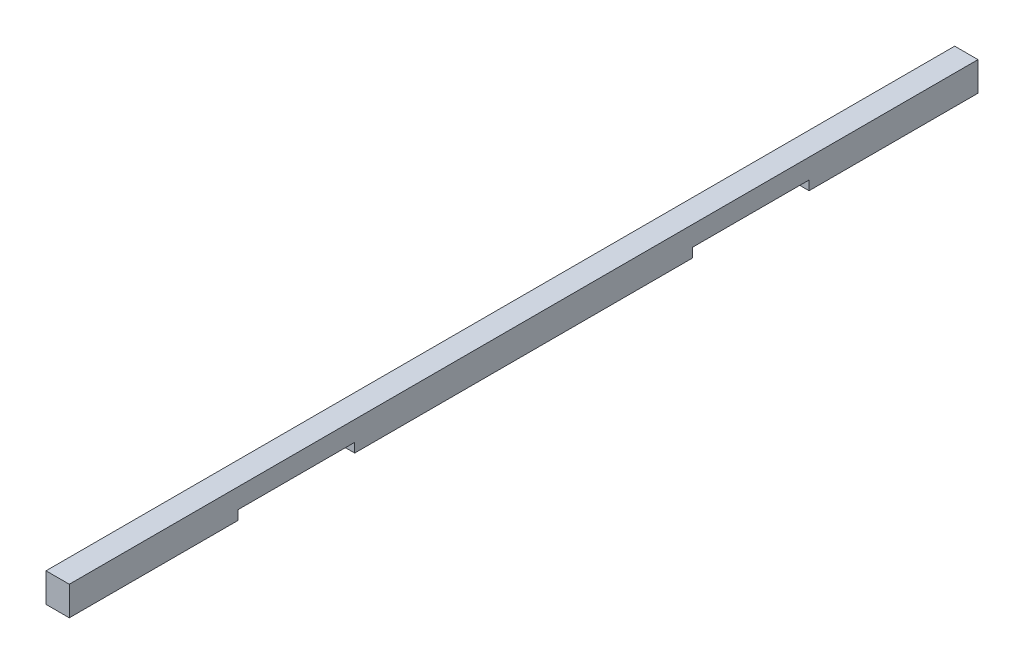
from build123d import *

# Parameters (mm, degrees)
EXTRUDE_1_OUTLINE_W = 25
EXTRUDE_1_OUTLINE_H = 780
EXTRUDE_1_DEPTH     = 20
SKETCH_2_W          = 100
SKETCH_2_H          = 8
CUT_EXTRUDE_1_DEPTH = 781.656774774


# Read off the part's stored shape, not the designer's step: Бобышка-Вытянуть1
with BuildPart() as part:
    # Бобышка-Вытянуть1 outline → Бобышка-Вытянуть1 (new body)
    with BuildSketch(Plane.YZ):
        with Locations((12.5, -390)):
            Rectangle(EXTRUDE_1_OUTLINE_W, EXTRUDE_1_OUTLINE_H)
    extrude(amount=EXTRUDE_1_DEPTH)

    # Эскиз2 → Вырез-Вытянуть1 (cut, through all)
    with BuildSketch(Plane(origin=(20, 0, 0), x_dir=(0, 0, -1), z_dir=(1, 0, 0))):
        with Locations((195, 4)):
            Rectangle(SKETCH_2_W, SKETCH_2_H)
        with Locations((585, 4)):
            Rectangle(SKETCH_2_W, SKETCH_2_H)
    extrude(amount=-CUT_EXTRUDE_1_DEPTH, mode=Mode.SUBTRACT)


solid = part.part
